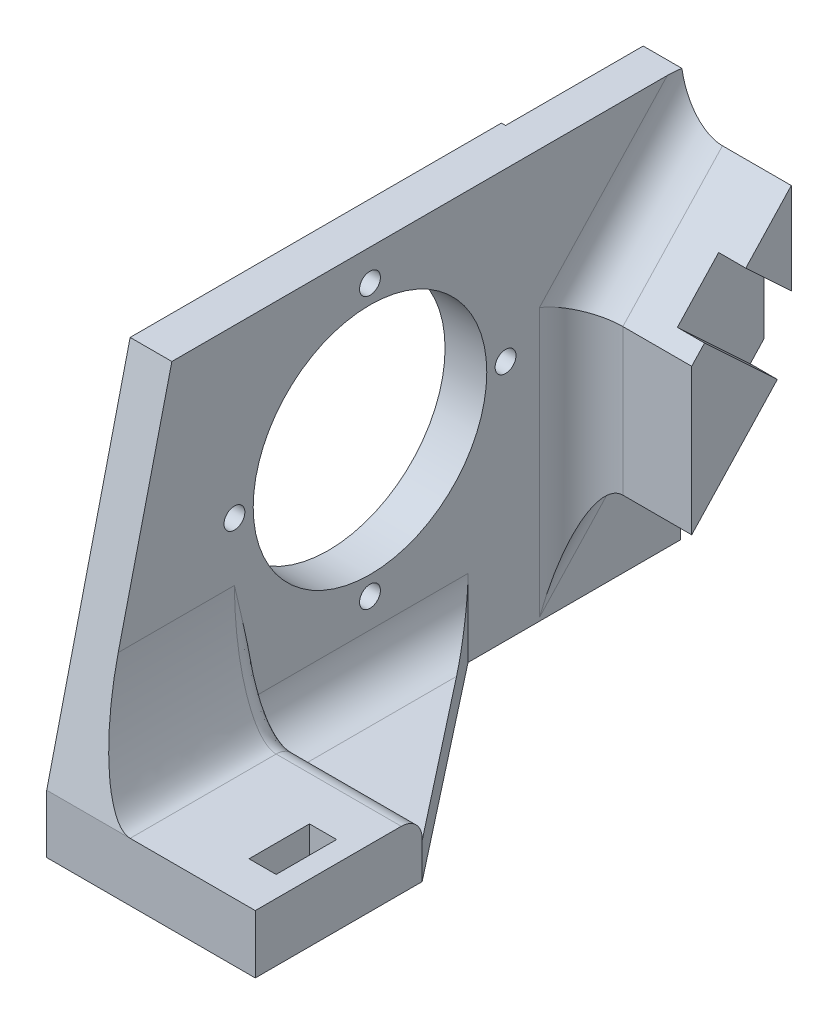
from build123d import *

# Parameters (mm, degrees)
SKETCH1_W                = 95
SKETCH1_H                = 80
SKETCH1_R                = 28
BOSS_EXTRUDE1_DEPTH      = 10
F_5_0_5_DIAMETER_HOLE1_D = 5
SKETCH4_W                = 95
SKETCH4_H                = 18
BOSS_EXTRUDE2_DEPTH      = 10
SKETCH6_W                = 20
SKETCH6_H                = 14
BOSS_EXTRUDE3_DEPTH      = 40
SKETCH10_W               = 50
SKETCH10_H               = 14
BOSS_EXTRUDE4_DEPTH      = 20
SKETCH9_W                = 6.5
SKETCH9_H                = 14.5
CUT_EXTRUDE1_DEPTH       = 20
BOSS_EXTRUDE5_DEPTH      = 5
FILLET3_SIZE             = 10
FILLET3_SIZE_2           = 30
SKETCH15_W               = 10
SKETCH15_H               = 98
CUT_EXTRUDE2_DEPTH       = 6
SKETCH16_W               = 9
SKETCH16_H               = 98
BOSS_EXTRUDE7_DEPTH      = 33
BOSS_EXTRUDE8_DEPTH      = 26.5
CUT_EXTRUDE3_DEPTH       = 6.5
FILLET4_R                = 10
BOSS_EXTRUDE9_DEPTH      = 8.5
FILLET5_R                = 5
FILLET6_R                = 10
CUT_EXTRUDE4_DEPTH       = 133.445770086
CUT_EXTRUDE4_DEPTH_BACK  = 133.445770086
SKETCH20_W               = 6.5
SKETCH20_H               = 14.5


with BuildPart() as part:
    # Sketch1 → Boss-Extrude1 (new body)
    with BuildSketch(Plane(origin=(0, 0, 0), x_dir=(0, 0, -1), z_dir=(1, 0, 0))):
        Rectangle(SKETCH1_W, SKETCH1_H)
        Circle(SKETCH1_R, mode=Mode.SUBTRACT)
    extrude(amount=BOSS_EXTRUDE1_DEPTH)

    # Ø5.0 (5) Diameter Hole1 (through all)
    with Locations(Plane(origin=(10, 0, 0), x_dir=(0, 0, -1), z_dir=(1, 0, 0))):
        with Locations((-32.5, 0), (0, 32.5), (32.5, 0), (0, -32.5)):
            Hole(F_5_0_5_DIAMETER_HOLE1_D / 2)

    # Sketch4 → Boss-Extrude2 (add)
    with BuildSketch(Plane(origin=(10, 0, 0), x_dir=(0, 0, -1), z_dir=(1, 0, 0))):
        with Locations((0, -49)):
            Rectangle(SKETCH4_W, SKETCH4_H)
    extrude(amount=-BOSS_EXTRUDE2_DEPTH)

    # Sketch6 → Boss-Extrude3 (add)
    with BuildSketch(Plane(origin=(10, 0, 0), x_dir=(0, 0, -1), z_dir=(1, 0, 0))):
        with Locations((-37.5, -51)):
            Rectangle(SKETCH6_W, SKETCH6_H)
    extrude(amount=BOSS_EXTRUDE3_DEPTH)

    # Sketch10 → Boss-Extrude4 (add)
    with BuildSketch(Plane.XY.offset(47.5)):
        with Locations((25, -51)):
            Rectangle(SKETCH10_W, SKETCH10_H)
    extrude(amount=BOSS_EXTRUDE4_DEPTH)

    # Sketch9 → Cut-Extrude1 (cut)
    with BuildSketch(Plane(origin=(0, -44, 0), x_dir=(1, 0, 0), z_dir=(0, 1, 0))):
        with Locations((41.75, -50.25)):
            Rectangle(SKETCH9_W, SKETCH9_H)
    extrude(amount=-CUT_EXTRUDE1_DEPTH, mode=Mode.SUBTRACT)

    # Sketch13 → Boss-Extrude5 (add, symmetric)
    with BuildSketch(Plane(origin=(5, 0, 0), x_dir=(0, 0, -1), z_dir=(1, 0, 0))):
        Polygon((-47.5, 40), (-67.5, -44), (-47.5, -44), align=None)
    extrude(amount=BOSS_EXTRUDE5_DEPTH, both=True)

    # Fillet3
    # an asymmetric fillet: 30, 10 mm, written as the material it adds along each edge
    with BuildSketch(Plane(origin=(10, -44, 67.5), x_dir=(1, 0, 0), z_dir=(0, 0, -1))) as fillet3_piece_1_section:
        with BuildLine():
            Bezier((FILLET3_SIZE, 0), (0, 0), (0, -FILLET3_SIZE_2), weights=[1, 0.707106781, 1])
            Line((0, -FILLET3_SIZE_2), (0, 0))
            Line((0, 0), (FILLET3_SIZE, 0))
        make_face()
    fillet3_piece_1 = extrude(amount=40, mode=Mode.PRIVATE)
    fillet3_piece_1 = split(fillet3_piece_1, bisect_by=Plane(origin=(11.956136852, -32.150515723, 64.67869422), z_dir=(0, -0.23162052730603974, -0.9728062146853669)), keep=Keep.TOP, mode=Mode.PRIVATE)
    add(fillet3_piece_1)

    # Sketch15 → Cut-Extrude2 (cut)
    with BuildSketch(Plane(origin=(0, 0, -47.5), x_dir=(-1, 0, 0), z_dir=(0, 0, -1))):
        with Locations((-5, -9)):
            Rectangle(SKETCH15_W, SKETCH15_H)
    extrude(amount=-CUT_EXTRUDE2_DEPTH, mode=Mode.SUBTRACT)

    # Sketch16 → Boss-Extrude7 (add)
    with BuildSketch(Plane(origin=(0, 0, -41.5), x_dir=(-1, 0, 0), z_dir=(0, 0, -1))):
        with Locations((-5.5, -9)):
            Rectangle(SKETCH16_W, SKETCH16_H)
    extrude(amount=BOSS_EXTRUDE7_DEPTH)

    # Sketch17 → Boss-Extrude8 (add)
    with BuildSketch(Plane(origin=(10, 0, 0), x_dir=(0, 0, -1), z_dir=(1, 0, 0))):
        Polygon((50.627369684, 3.19117124), (74.5, 28.786044199), (74.5, -6.213955801), (50.627369684, -31.80882876), align=None)
    extrude(amount=BOSS_EXTRUDE8_DEPTH)

    # Sketch18 → Cut-Extrude3 (cut)
    with BuildSketch(Plane(origin=(36.5, 0, 0), x_dir=(0, 0, -1), z_dir=(1, 0, 0))):
        Polygon((53.696707867, 6.481940621), (61.009528713, -0.338810898), (70.899618415, 10.264779328), (63.58679757, 17.085530846), align=None)
    extrude(amount=-CUT_EXTRUDE3_DEPTH, mode=Mode.SUBTRACT)

    # Fillet4
    fillet4_edges = [part.edges().sort_by_distance(p)[0] for p in [
        (10, 15.98860772, -62.563684842),
        (10, -14.30882876, -50.627369684),
        (10, -19.01139228, -62.563684842),
    ]]
    fillet(fillet4_edges, radius=FILLET4_R)

    # Sketch19 → Boss-Extrude9 (add)
    with BuildSketch(Plane.XZ.offset(58)):
        Polygon((50, 27.5), (10, -23.5), (10, 27.5), align=None)
    extrude(amount=-BOSS_EXTRUDE9_DEPTH)

    # Fillet5
    fillet5_edges = [part.edges().sort_by_distance(p)[0] for p in [
        (35, -44, 27.5),
    ]]
    fillet(fillet5_edges, radius=FILLET5_R)

    # Fillet6
    fillet6_edges = [part.edges().sort_by_distance(p)[0] for p in [
        (10, -49.5, 2),
    ]]
    fillet(fillet6_edges, radius=FILLET6_R)

    # Sketch20 → Cut-Extrude4 (cut, two sides: drawn at the far end of the back side and taken through both)
    with BuildSketch(Plane(origin=(0, -30.588526305, -32.795273685), x_dir=(1, 0, 0), z_dir=(0, 0.6820751518904317, 0.731282084543061)).offset(-CUT_EXTRUDE4_DEPTH_BACK)):
        with Locations((33.25, 48.615317224)):
            Rectangle(SKETCH20_W, SKETCH20_H)
    extrude(amount=CUT_EXTRUDE4_DEPTH + CUT_EXTRUDE4_DEPTH_BACK, mode=Mode.SUBTRACT)


solid = part.part
